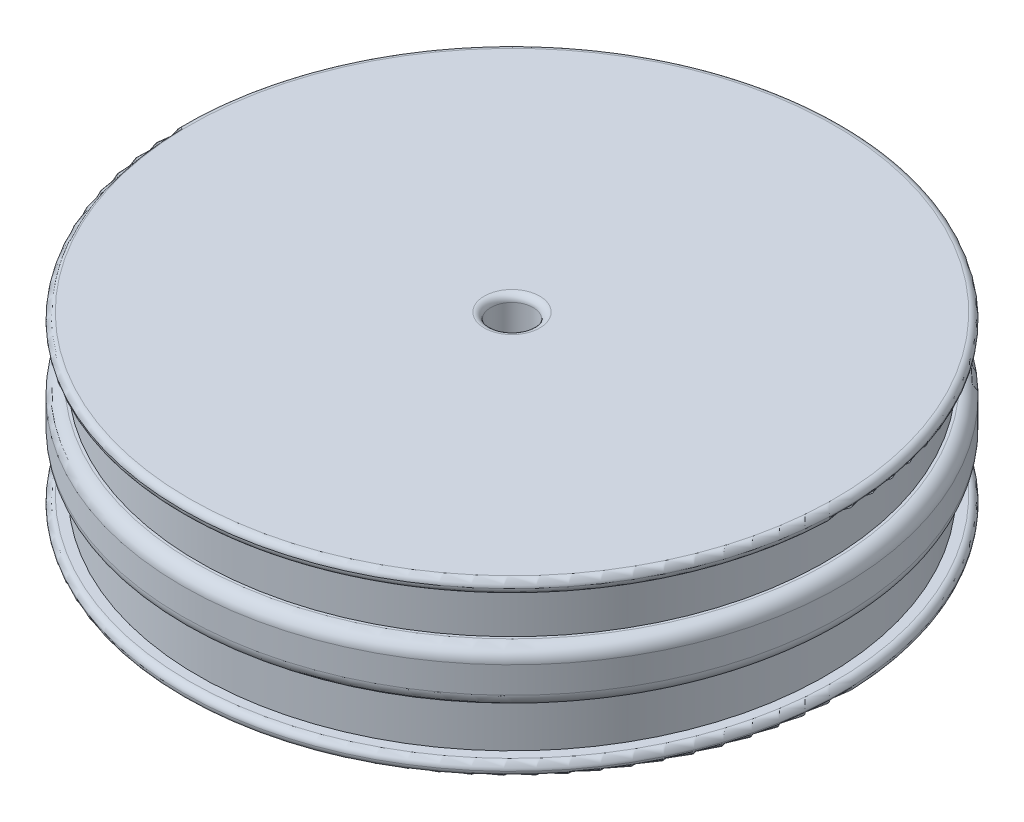
from build123d import *

# Parameters (mm, degrees)
SKETCH1_R           = 25
SKETCH1_R_2         = 1.6
BOSS_EXTRUDE1_DEPTH = 13
SKETCH3_W           = 1.2
SKETCH3_H           = 3.5
FILLET1_R           = 1
FILLET2_R           = 0.5
FILLET3_R           = 0.5
FILLET4_R           = 0.5


with BuildPart() as part:
    # Sketch1 → Boss-Extrude1 (new body)
    with BuildSketch(Plane(origin=(0, 0, 0), x_dir=(1, 0, 0), z_dir=(0, 1, 0))):
        with Locations(Location((0, 0, 0), (0, 0, 90))):
            Circle(SKETCH1_R)
        with Locations(Location((0, 0, 0), (0, 0, 90))):
            Circle(SKETCH1_R_2, mode=Mode.SUBTRACT)
    extrude(amount=BOSS_EXTRUDE1_DEPTH)

    # Sketch3 → Cut-Revolve1 (revolve, cut)
    with BuildSketch(Plane(origin=(0, 0, 0), x_dir=(0, 0, -1), z_dir=(1, 0, 0)), mode=Mode.PRIVATE) as cut_revolve1_sk:
        with Locations((-24.4, 10.25)):
            Rectangle(SKETCH3_W, SKETCH3_H)
        with Locations((-24.4, 2.75)):
            Rectangle(SKETCH3_W, SKETCH3_H)
    revolve(cut_revolve1_sk.sketch.rotate(Axis((0, -0.54344918, 0), (0, 1, 0)), 180), axis=Axis((0, -0.54344918, 0), (0, 1, 0)), mode=Mode.SUBTRACT)

    # Fillet1
    fillet1_edges = [part.edges().sort_by_distance(p)[0] for p in [
        (0, 8.5, 25),
        (0, 4.5, 25),
    ]]
    fillet(fillet1_edges, radius=FILLET1_R)

    # Fillet2
    fillet2_edges = [part.edges().sort_by_distance(p)[0] for p in [
        (0, 12, 25),
        (0, 1, 25),
    ]]
    fillet(fillet2_edges, radius=FILLET2_R)

    # Fillet3
    fillet3_edges = [part.edges().sort_by_distance(p)[0] for p in [
        (0, 0, 25),
        (0, 13, 25),
    ]]
    fillet(fillet3_edges, radius=FILLET3_R - 0.0001)  # a hair under: the kernel refuses the full size

    # Fillet4
    fillet4_edges = [part.edges().sort_by_distance(p)[0] for p in [
        (0, 0, 1.6),
        (0, 13, 1.6),
    ]]
    fillet(fillet4_edges, radius=FILLET4_R)


solid = part.part
